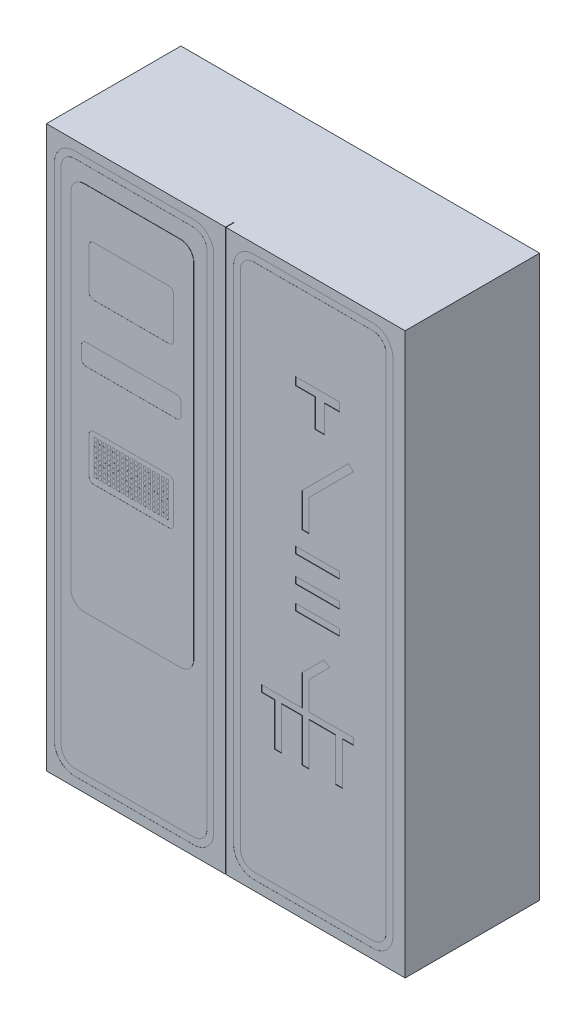
from build123d import *

# Parameters (mm, degrees)
CROQUIS1_W                 = 1600
CROQUIS1_H                 = 600
SALIENTE_EXTRUIR1_DEPTH    = 2500
CROQUIS2_W                 = 2
CROQUIS2_H                 = 2500
CORTAR_EXTRUIR1_DEPTH      = 38
CORTAR_EXTRUIR2_DEPTH      = 0.2
SALIENTE_EXTRUIR2_DEPTH    = 1
CROQUIS5_W                 = 195.337479374
CROQUIS5_H                 = 30
CORTAR_EXTRUIR3_DEPTH      = 2
CORTAR_EXTRUIR4_DEPTH      = 0.2
CROQUIS7_W                 = 12.38480667
CROQUIS7_H                 = 15.762481217
CORTAR_EXTRUIR5_DEPTH      = 0.1
MATRIZL1_COUNT             = 17
MATRIZL1_PITCH             = 20
MATRIZL2_COPY_1_SKETCH_W   = 12.38480667
MATRIZL2_COPY_1_SKETCH_H   = 15.762481217
MATRIZL2_COPY_1_DEPTH      = 0.1
MATRIZL2_COPY_2_SKETCH_W   = 12.38480667
MATRIZL2_COPY_2_SKETCH_H   = 15.762481217
MATRIZL2_COPY_2_DEPTH      = 0.1
MATRIZL2_COPY_3_SKETCH_W   = 12.38480667
MATRIZL2_COPY_3_SKETCH_H   = 15.762481217
MATRIZL2_COPY_3_DEPTH      = 0.1
MATRIZL2_COPY_4_SKETCH_W   = 12.38480667
MATRIZL2_COPY_4_SKETCH_H   = 15.762481217
MATRIZL2_COPY_4_DEPTH      = 0.1
MATRIZL2_COPY_5_SKETCH_W   = 12.38480667
MATRIZL2_COPY_5_SKETCH_H   = 15.762481217
MATRIZL2_COPY_5_DEPTH      = 0.1
MATRIZL2_COPY_6_SKETCH_W   = 12.38480667
MATRIZL2_COPY_6_SKETCH_H   = 15.762481217
MATRIZL2_COPY_6_DEPTH      = 0.1
MATRIZL2_COPY_7_SKETCH_W   = 12.38480667
MATRIZL2_COPY_7_SKETCH_H   = 15.762481217
MATRIZL2_COPY_7_DEPTH      = 0.1
MATRIZL2_COPY_8_SKETCH_W   = 12.38480667
MATRIZL2_COPY_8_SKETCH_H   = 15.762481217
MATRIZL2_COPY_8_DEPTH      = 0.1
MATRIZL2_COPY_9_SKETCH_W   = 12.38480667
MATRIZL2_COPY_9_SKETCH_H   = 15.762481217
MATRIZL2_COPY_9_DEPTH      = 0.1
MATRIZL2_COPY_10_SKETCH_W  = 12.38480667
MATRIZL2_COPY_10_SKETCH_H  = 15.762481217
MATRIZL2_COPY_10_DEPTH     = 0.1
MATRIZL2_COPY_11_SKETCH_W  = 12.38480667
MATRIZL2_COPY_11_SKETCH_H  = 15.762481217
MATRIZL2_COPY_11_DEPTH     = 0.1
MATRIZL2_COPY_12_SKETCH_W  = 12.38480667
MATRIZL2_COPY_12_SKETCH_H  = 15.762481217
MATRIZL2_COPY_12_DEPTH     = 0.1
MATRIZL2_COPY_13_SKETCH_W  = 12.38480667
MATRIZL2_COPY_13_SKETCH_H  = 15.762481217
MATRIZL2_COPY_13_DEPTH     = 0.1
MATRIZL2_COPY_14_SKETCH_W  = 12.38480667
MATRIZL2_COPY_14_SKETCH_H  = 15.762481217
MATRIZL2_COPY_14_DEPTH     = 0.1
MATRIZL2_COPY_15_SKETCH_W  = 12.38480667
MATRIZL2_COPY_15_SKETCH_H  = 15.762481217
MATRIZL2_COPY_15_DEPTH     = 0.1
MATRIZL2_COPY_16_SKETCH_W  = 12.38480667
MATRIZL2_COPY_16_SKETCH_H  = 15.762481217
MATRIZL2_COPY_16_DEPTH     = 0.1
MATRIZL2_COPY_17_SKETCH_W  = 12.38480667
MATRIZL2_COPY_17_SKETCH_H  = 15.762481217
MATRIZL2_COPY_17_DEPTH     = 0.1
MATRIZL2_COPY_18_SKETCH_W  = 12.38480667
MATRIZL2_COPY_18_SKETCH_H  = 15.762481217
MATRIZL2_COPY_18_DEPTH     = 0.1
MATRIZL2_COPY_19_SKETCH_W  = 12.38480667
MATRIZL2_COPY_19_SKETCH_H  = 15.762481217
MATRIZL2_COPY_19_DEPTH     = 0.1
MATRIZL2_COPY_20_SKETCH_W  = 12.38480667
MATRIZL2_COPY_20_SKETCH_H  = 15.762481217
MATRIZL2_COPY_20_DEPTH     = 0.1
MATRIZL2_COPY_21_SKETCH_W  = 12.38480667
MATRIZL2_COPY_21_SKETCH_H  = 15.762481217
MATRIZL2_COPY_21_DEPTH     = 0.1
MATRIZL2_COPY_22_SKETCH_W  = 12.38480667
MATRIZL2_COPY_22_SKETCH_H  = 15.762481217
MATRIZL2_COPY_22_DEPTH     = 0.1
MATRIZL2_COPY_23_SKETCH_W  = 12.38480667
MATRIZL2_COPY_23_SKETCH_H  = 15.762481217
MATRIZL2_COPY_23_DEPTH     = 0.1
MATRIZL2_COPY_24_SKETCH_W  = 12.38480667
MATRIZL2_COPY_24_SKETCH_H  = 15.762481217
MATRIZL2_COPY_24_DEPTH     = 0.1
MATRIZL2_COPY_25_SKETCH_W  = 12.38480667
MATRIZL2_COPY_25_SKETCH_H  = 15.762481217
MATRIZL2_COPY_25_DEPTH     = 0.1
MATRIZL2_COPY_26_SKETCH_W  = 12.38480667
MATRIZL2_COPY_26_SKETCH_H  = 15.762481217
MATRIZL2_COPY_26_DEPTH     = 0.1
MATRIZL2_COPY_27_SKETCH_W  = 12.38480667
MATRIZL2_COPY_27_SKETCH_H  = 15.762481217
MATRIZL2_COPY_27_DEPTH     = 0.1
MATRIZL2_COPY_28_SKETCH_W  = 12.38480667
MATRIZL2_COPY_28_SKETCH_H  = 15.762481217
MATRIZL2_COPY_28_DEPTH     = 0.1
MATRIZL2_COPY_29_SKETCH_W  = 12.38480667
MATRIZL2_COPY_29_SKETCH_H  = 15.762481217
MATRIZL2_COPY_29_DEPTH     = 0.1
MATRIZL2_COPY_30_SKETCH_W  = 12.38480667
MATRIZL2_COPY_30_SKETCH_H  = 15.762481217
MATRIZL2_COPY_30_DEPTH     = 0.1
MATRIZL2_COPY_31_SKETCH_W  = 12.38480667
MATRIZL2_COPY_31_SKETCH_H  = 15.762481217
MATRIZL2_COPY_31_DEPTH     = 0.1
MATRIZL2_COPY_32_SKETCH_W  = 12.38480667
MATRIZL2_COPY_32_SKETCH_H  = 15.762481217
MATRIZL2_COPY_32_DEPTH     = 0.1
MATRIZL2_COPY_33_SKETCH_W  = 12.38480667
MATRIZL2_COPY_33_SKETCH_H  = 15.762481217
MATRIZL2_COPY_33_DEPTH     = 0.1
MATRIZL2_COPY_34_SKETCH_W  = 12.38480667
MATRIZL2_COPY_34_SKETCH_H  = 15.762481217
MATRIZL2_COPY_34_DEPTH     = 0.1
MATRIZL2_COPY_35_SKETCH_W  = 12.38480667
MATRIZL2_COPY_35_SKETCH_H  = 15.762481217
MATRIZL2_COPY_35_DEPTH     = 0.1
MATRIZL2_COPY_36_SKETCH_W  = 12.38480667
MATRIZL2_COPY_36_SKETCH_H  = 15.762481217
MATRIZL2_COPY_36_DEPTH     = 0.1
MATRIZL2_COPY_37_SKETCH_W  = 12.38480667
MATRIZL2_COPY_37_SKETCH_H  = 15.762481217
MATRIZL2_COPY_37_DEPTH     = 0.1
MATRIZL2_COPY_38_SKETCH_W  = 12.38480667
MATRIZL2_COPY_38_SKETCH_H  = 15.762481217
MATRIZL2_COPY_38_DEPTH     = 0.1
MATRIZL2_COPY_39_SKETCH_W  = 12.38480667
MATRIZL2_COPY_39_SKETCH_H  = 15.762481217
MATRIZL2_COPY_39_DEPTH     = 0.1
MATRIZL2_COPY_40_SKETCH_W  = 12.38480667
MATRIZL2_COPY_40_SKETCH_H  = 15.762481217
MATRIZL2_COPY_40_DEPTH     = 0.1
MATRIZL2_COPY_41_SKETCH_W  = 12.38480667
MATRIZL2_COPY_41_SKETCH_H  = 15.762481217
MATRIZL2_COPY_41_DEPTH     = 0.1
MATRIZL2_COPY_42_SKETCH_W  = 12.38480667
MATRIZL2_COPY_42_SKETCH_H  = 15.762481217
MATRIZL2_COPY_42_DEPTH     = 0.1
MATRIZL2_COPY_43_SKETCH_W  = 12.38480667
MATRIZL2_COPY_43_SKETCH_H  = 15.762481217
MATRIZL2_COPY_43_DEPTH     = 0.1
MATRIZL2_COPY_44_SKETCH_W  = 12.38480667
MATRIZL2_COPY_44_SKETCH_H  = 15.762481217
MATRIZL2_COPY_44_DEPTH     = 0.1
MATRIZL2_COPY_45_SKETCH_W  = 12.38480667
MATRIZL2_COPY_45_SKETCH_H  = 15.762481217
MATRIZL2_COPY_45_DEPTH     = 0.1
MATRIZL2_COPY_46_SKETCH_W  = 12.38480667
MATRIZL2_COPY_46_SKETCH_H  = 15.762481217
MATRIZL2_COPY_46_DEPTH     = 0.1
MATRIZL2_COPY_47_SKETCH_W  = 12.38480667
MATRIZL2_COPY_47_SKETCH_H  = 15.762481217
MATRIZL2_COPY_47_DEPTH     = 0.1
MATRIZL2_COPY_48_SKETCH_W  = 12.38480667
MATRIZL2_COPY_48_SKETCH_H  = 15.762481217
MATRIZL2_COPY_48_DEPTH     = 0.1
MATRIZL2_COPY_49_SKETCH_W  = 12.38480667
MATRIZL2_COPY_49_SKETCH_H  = 15.762481217
MATRIZL2_COPY_49_DEPTH     = 0.1
MATRIZL2_COPY_50_SKETCH_W  = 12.38480667
MATRIZL2_COPY_50_SKETCH_H  = 15.762481217
MATRIZL2_COPY_50_DEPTH     = 0.1
MATRIZL2_COPY_51_SKETCH_W  = 12.38480667
MATRIZL2_COPY_51_SKETCH_H  = 15.762481217
MATRIZL2_COPY_51_DEPTH     = 0.1
MATRIZL2_COPY_52_SKETCH_W  = 12.38480667
MATRIZL2_COPY_52_SKETCH_H  = 15.762481217
MATRIZL2_COPY_52_DEPTH     = 0.1
MATRIZL2_COPY_53_SKETCH_W  = 12.38480667
MATRIZL2_COPY_53_SKETCH_H  = 15.762481217
MATRIZL2_COPY_53_DEPTH     = 0.1
MATRIZL2_COPY_54_SKETCH_W  = 12.38480667
MATRIZL2_COPY_54_SKETCH_H  = 15.762481217
MATRIZL2_COPY_54_DEPTH     = 0.1
MATRIZL2_COPY_55_SKETCH_W  = 12.38480667
MATRIZL2_COPY_55_SKETCH_H  = 15.762481217
MATRIZL2_COPY_55_DEPTH     = 0.1
MATRIZL2_COPY_56_SKETCH_W  = 12.38480667
MATRIZL2_COPY_56_SKETCH_H  = 15.762481217
MATRIZL2_COPY_56_DEPTH     = 0.1
MATRIZL2_COPY_57_SKETCH_W  = 12.38480667
MATRIZL2_COPY_57_SKETCH_H  = 15.762481217
MATRIZL2_COPY_57_DEPTH     = 0.1
MATRIZL2_COPY_58_SKETCH_W  = 12.38480667
MATRIZL2_COPY_58_SKETCH_H  = 15.762481217
MATRIZL2_COPY_58_DEPTH     = 0.1
MATRIZL2_COPY_59_SKETCH_W  = 12.38480667
MATRIZL2_COPY_59_SKETCH_H  = 15.762481217
MATRIZL2_COPY_59_DEPTH     = 0.1
MATRIZL2_COPY_60_SKETCH_W  = 12.38480667
MATRIZL2_COPY_60_SKETCH_H  = 15.762481217
MATRIZL2_COPY_60_DEPTH     = 0.1
MATRIZL2_COPY_61_SKETCH_W  = 12.38480667
MATRIZL2_COPY_61_SKETCH_H  = 15.762481217
MATRIZL2_COPY_61_DEPTH     = 0.1
MATRIZL2_COPY_62_SKETCH_W  = 12.38480667
MATRIZL2_COPY_62_SKETCH_H  = 15.762481217
MATRIZL2_COPY_62_DEPTH     = 0.1
MATRIZL2_COPY_63_SKETCH_W  = 12.38480667
MATRIZL2_COPY_63_SKETCH_H  = 15.762481217
MATRIZL2_COPY_63_DEPTH     = 0.1
MATRIZL2_COPY_64_SKETCH_W  = 12.38480667
MATRIZL2_COPY_64_SKETCH_H  = 15.762481217
MATRIZL2_COPY_64_DEPTH     = 0.1
MATRIZL2_COPY_65_SKETCH_W  = 12.38480667
MATRIZL2_COPY_65_SKETCH_H  = 15.762481217
MATRIZL2_COPY_65_DEPTH     = 0.1
MATRIZL2_COPY_66_SKETCH_W  = 12.38480667
MATRIZL2_COPY_66_SKETCH_H  = 15.762481217
MATRIZL2_COPY_66_DEPTH     = 0.1
MATRIZL2_COPY_67_SKETCH_W  = 12.38480667
MATRIZL2_COPY_67_SKETCH_H  = 15.762481217
MATRIZL2_COPY_67_DEPTH     = 0.1
MATRIZL2_COPY_68_SKETCH_W  = 12.38480667
MATRIZL2_COPY_68_SKETCH_H  = 15.762481217
MATRIZL2_COPY_68_DEPTH     = 0.1
MATRIZL2_COPY_69_SKETCH_W  = 12.38480667
MATRIZL2_COPY_69_SKETCH_H  = 15.762481217
MATRIZL2_COPY_69_DEPTH     = 0.1
MATRIZL2_COPY_70_SKETCH_W  = 12.38480667
MATRIZL2_COPY_70_SKETCH_H  = 15.762481217
MATRIZL2_COPY_70_DEPTH     = 0.1
MATRIZL2_COPY_71_SKETCH_W  = 12.38480667
MATRIZL2_COPY_71_SKETCH_H  = 15.762481217
MATRIZL2_COPY_71_DEPTH     = 0.1
MATRIZL2_COPY_72_SKETCH_W  = 12.38480667
MATRIZL2_COPY_72_SKETCH_H  = 15.762481217
MATRIZL2_COPY_72_DEPTH     = 0.1
MATRIZL2_COPY_73_SKETCH_W  = 12.38480667
MATRIZL2_COPY_73_SKETCH_H  = 15.762481217
MATRIZL2_COPY_73_DEPTH     = 0.1
MATRIZL2_COPY_74_SKETCH_W  = 12.38480667
MATRIZL2_COPY_74_SKETCH_H  = 15.762481217
MATRIZL2_COPY_74_DEPTH     = 0.1
MATRIZL2_COPY_75_SKETCH_W  = 12.38480667
MATRIZL2_COPY_75_SKETCH_H  = 15.762481217
MATRIZL2_COPY_75_DEPTH     = 0.1
MATRIZL2_COPY_76_SKETCH_W  = 12.38480667
MATRIZL2_COPY_76_SKETCH_H  = 15.762481217
MATRIZL2_COPY_76_DEPTH     = 0.1
MATRIZL2_COPY_77_SKETCH_W  = 12.38480667
MATRIZL2_COPY_77_SKETCH_H  = 15.762481217
MATRIZL2_COPY_77_DEPTH     = 0.1
MATRIZL2_COPY_78_SKETCH_W  = 12.38480667
MATRIZL2_COPY_78_SKETCH_H  = 15.762481217
MATRIZL2_COPY_78_DEPTH     = 0.1
MATRIZL2_COPY_79_SKETCH_W  = 12.38480667
MATRIZL2_COPY_79_SKETCH_H  = 15.762481217
MATRIZL2_COPY_79_DEPTH     = 0.1
MATRIZL2_COPY_80_SKETCH_W  = 12.38480667
MATRIZL2_COPY_80_SKETCH_H  = 15.762481217
MATRIZL2_COPY_80_DEPTH     = 0.1
MATRIZL2_COPY_81_SKETCH_W  = 12.38480667
MATRIZL2_COPY_81_SKETCH_H  = 15.762481217
MATRIZL2_COPY_81_DEPTH     = 0.1
MATRIZL2_COPY_82_SKETCH_W  = 12.38480667
MATRIZL2_COPY_82_SKETCH_H  = 15.762481217
MATRIZL2_COPY_82_DEPTH     = 0.1
MATRIZL2_COPY_83_SKETCH_W  = 12.38480667
MATRIZL2_COPY_83_SKETCH_H  = 15.762481217
MATRIZL2_COPY_83_DEPTH     = 0.1
MATRIZL2_COPY_84_SKETCH_W  = 12.38480667
MATRIZL2_COPY_84_SKETCH_H  = 15.762481217
MATRIZL2_COPY_84_DEPTH     = 0.1
MATRIZL2_COPY_85_SKETCH_W  = 12.38480667
MATRIZL2_COPY_85_SKETCH_H  = 15.762481217
MATRIZL2_COPY_85_DEPTH     = 0.1
MATRIZL2_COPY_86_SKETCH_W  = 12.38480667
MATRIZL2_COPY_86_SKETCH_H  = 15.762481217
MATRIZL2_COPY_86_DEPTH     = 0.1
MATRIZL2_COPY_87_SKETCH_W  = 12.38480667
MATRIZL2_COPY_87_SKETCH_H  = 15.762481217
MATRIZL2_COPY_87_DEPTH     = 0.1
MATRIZL2_COPY_88_SKETCH_W  = 12.38480667
MATRIZL2_COPY_88_SKETCH_H  = 15.762481217
MATRIZL2_COPY_88_DEPTH     = 0.1
MATRIZL2_COPY_89_SKETCH_W  = 12.38480667
MATRIZL2_COPY_89_SKETCH_H  = 15.762481217
MATRIZL2_COPY_89_DEPTH     = 0.1
MATRIZL2_COPY_90_SKETCH_W  = 12.38480667
MATRIZL2_COPY_90_SKETCH_H  = 15.762481217
MATRIZL2_COPY_90_DEPTH     = 0.1
MATRIZL2_COPY_91_SKETCH_W  = 12.38480667
MATRIZL2_COPY_91_SKETCH_H  = 15.762481217
MATRIZL2_COPY_91_DEPTH     = 0.1
MATRIZL2_COPY_92_SKETCH_W  = 12.38480667
MATRIZL2_COPY_92_SKETCH_H  = 15.762481217
MATRIZL2_COPY_92_DEPTH     = 0.1
MATRIZL2_COPY_93_SKETCH_W  = 12.38480667
MATRIZL2_COPY_93_SKETCH_H  = 15.762481217
MATRIZL2_COPY_93_DEPTH     = 0.1
MATRIZL2_COPY_94_SKETCH_W  = 12.38480667
MATRIZL2_COPY_94_SKETCH_H  = 15.762481217
MATRIZL2_COPY_94_DEPTH     = 0.1
MATRIZL2_COPY_95_SKETCH_W  = 12.38480667
MATRIZL2_COPY_95_SKETCH_H  = 15.762481217
MATRIZL2_COPY_95_DEPTH     = 0.1
MATRIZL2_COPY_96_SKETCH_W  = 12.38480667
MATRIZL2_COPY_96_SKETCH_H  = 15.762481217
MATRIZL2_COPY_96_DEPTH     = 0.1
MATRIZL2_COPY_97_SKETCH_W  = 12.38480667
MATRIZL2_COPY_97_SKETCH_H  = 15.762481217
MATRIZL2_COPY_97_DEPTH     = 0.1
MATRIZL2_COPY_98_SKETCH_W  = 12.38480667
MATRIZL2_COPY_98_SKETCH_H  = 15.762481217
MATRIZL2_COPY_98_DEPTH     = 0.1
MATRIZL2_COPY_99_SKETCH_W  = 12.38480667
MATRIZL2_COPY_99_SKETCH_H  = 15.762481217
MATRIZL2_COPY_99_DEPTH     = 0.1
MATRIZL2_COPY_100_SKETCH_W = 12.38480667
MATRIZL2_COPY_100_SKETCH_H = 15.762481217
MATRIZL2_COPY_100_DEPTH    = 0.1
MATRIZL2_COPY_101_SKETCH_W = 12.38480667
MATRIZL2_COPY_101_SKETCH_H = 15.762481217
MATRIZL2_COPY_101_DEPTH    = 0.1
MATRIZL2_COPY_102_SKETCH_W = 12.38480667
MATRIZL2_COPY_102_SKETCH_H = 15.762481217
MATRIZL2_COPY_102_DEPTH    = 0.1
MATRIZL2_COPY_103_SKETCH_W = 12.38480667
MATRIZL2_COPY_103_SKETCH_H = 15.762481217
MATRIZL2_COPY_103_DEPTH    = 0.1
MATRIZL2_COPY_104_SKETCH_W = 12.38480667
MATRIZL2_COPY_104_SKETCH_H = 15.762481217
MATRIZL2_COPY_104_DEPTH    = 0.1
MATRIZL2_COPY_105_SKETCH_W = 12.38480667
MATRIZL2_COPY_105_SKETCH_H = 15.762481217
MATRIZL2_COPY_105_DEPTH    = 0.1
MATRIZL2_COPY_106_SKETCH_W = 12.38480667
MATRIZL2_COPY_106_SKETCH_H = 15.762481217
MATRIZL2_COPY_106_DEPTH    = 0.1
MATRIZL2_COPY_107_SKETCH_W = 12.38480667
MATRIZL2_COPY_107_SKETCH_H = 15.762481217
MATRIZL2_COPY_107_DEPTH    = 0.1
MATRIZL2_COPY_108_SKETCH_W = 12.38480667
MATRIZL2_COPY_108_SKETCH_H = 15.762481217
MATRIZL2_COPY_108_DEPTH    = 0.1
MATRIZL2_COPY_109_SKETCH_W = 12.38480667
MATRIZL2_COPY_109_SKETCH_H = 15.762481217
MATRIZL2_COPY_109_DEPTH    = 0.1
MATRIZL2_COPY_110_SKETCH_W = 12.38480667
MATRIZL2_COPY_110_SKETCH_H = 15.762481217
MATRIZL2_COPY_110_DEPTH    = 0.1
MATRIZL2_COPY_111_SKETCH_W = 12.38480667
MATRIZL2_COPY_111_SKETCH_H = 15.762481217
MATRIZL2_COPY_111_DEPTH    = 0.1
MATRIZL2_COPY_112_SKETCH_W = 12.38480667
MATRIZL2_COPY_112_SKETCH_H = 15.762481217
MATRIZL2_COPY_112_DEPTH    = 0.1
MATRIZL2_COPY_113_SKETCH_W = 12.38480667
MATRIZL2_COPY_113_SKETCH_H = 15.762481217
MATRIZL2_COPY_113_DEPTH    = 0.1
MATRIZL2_COPY_114_SKETCH_W = 12.38480667
MATRIZL2_COPY_114_SKETCH_H = 15.762481217
MATRIZL2_COPY_114_DEPTH    = 0.1
MATRIZL2_COPY_115_SKETCH_W = 12.38480667
MATRIZL2_COPY_115_SKETCH_H = 15.762481217
MATRIZL2_COPY_115_DEPTH    = 0.1
MATRIZL2_COPY_116_SKETCH_W = 12.38480667
MATRIZL2_COPY_116_SKETCH_H = 15.762481217
MATRIZL2_COPY_116_DEPTH    = 0.1
MATRIZL2_COPY_117_SKETCH_W = 12.38480667
MATRIZL2_COPY_117_SKETCH_H = 15.762481217
MATRIZL2_COPY_117_DEPTH    = 0.1
MATRIZL2_COPY_118_SKETCH_W = 12.38480667
MATRIZL2_COPY_118_SKETCH_H = 15.762481217
MATRIZL2_COPY_118_DEPTH    = 0.1
MATRIZL2_COPY_119_SKETCH_W = 12.38480667
MATRIZL2_COPY_119_SKETCH_H = 15.762481217
MATRIZL2_COPY_119_DEPTH    = 0.1


with BuildPart() as part:
    # Croquis1 → Saliente-Extruir1 (new body)
    with BuildSketch(Plane(origin=(0, 0, 0), x_dir=(1, 0, 0), z_dir=(0, 1, 0))):
        Rectangle(CROQUIS1_W, CROQUIS1_H)
    extrude(amount=SALIENTE_EXTRUIR1_DEPTH)

    # Croquis2 → Cortar-Extruir1 (cut)
    with BuildSketch(Plane.XY.offset(300)):
        with Locations((0, 1250)):
            Rectangle(CROQUIS2_W, CROQUIS2_H)
    extrude(amount=-CORTAR_EXTRUIR1_DEPTH, mode=Mode.SUBTRACT)

    # Croquis3 → Cortar-Extruir2 (cut)
    # profile 1 of 2: a face of its own
    with BuildSketch(Plane.XY.offset(300)):
        with BuildLine():
            Line((-764.129970229, 2368.24689449), (-764.129970229, 132.91731919))
            ThreePointArc((-764.129970229, 132.91731919), (-737.769580535, 69.277708883), (-674.129970229, 42.91731919))
            Line((-674.129970229, 42.91731919), (-143.709851283, 42.91731919))
            ThreePointArc((-143.709851283, 42.91731919), (-80.070240976, 69.277708883), (-53.709851283, 132.91731919))
            Line((-53.709851283, 132.91731919), (-53.709851283, 2368.24689449))
            ThreePointArc((-53.709851283, 2368.24689449), (-80.070240976, 2431.886504796), (-143.709851283, 2458.24689449))
            Line((-143.709851283, 2458.24689449), (-674.129970229, 2458.24689449))
            ThreePointArc((-674.129970229, 2458.24689449), (-737.769580535, 2431.886504796), (-764.129970229, 2368.24689449))
        make_face()
        with BuildLine():
            Line((-674.129970229, 2428.24689449), (-143.709851283, 2428.24689449))
            ThreePointArc((-143.709851283, 2428.24689449), (-101.283444412, 2410.673301361), (-83.709851283, 2368.24689449))
            Line((-83.709851283, 2368.24689449), (-83.709851283, 132.91731919))
            ThreePointArc((-83.709851283, 132.91731919), (-101.283444412, 90.490912319), (-143.709851283, 72.91731919))
            Line((-143.709851283, 72.91731919), (-674.129970229, 72.91731919))
            ThreePointArc((-674.129970229, 72.91731919), (-716.5563771, 90.490912319), (-734.129970229, 132.91731919))
            Line((-734.129970229, 132.91731919), (-734.129970229, 2368.24689449))
            ThreePointArc((-734.129970229, 2368.24689449), (-716.5563771, 2410.673301361), (-674.129970229, 2428.24689449))
        make_face(mode=Mode.SUBTRACT)
    # profile 2 of 2: a face of its own
    with BuildSketch(Plane.XY.offset(300)):
        with BuildLine():
            Line((34.95246111, 2368.24689449), (34.95246111, 132.91731919))
            ThreePointArc((34.95246111, 132.91731919), (61.312850804, 69.277708883), (124.95246111, 42.91731919))
            Line((124.95246111, 42.91731919), (655.451268753, 42.91731919))
            ThreePointArc((655.451268753, 42.91731919), (719.09087906, 69.277708883), (745.451268753, 132.91731919))
            Line((745.451268753, 132.91731919), (745.451268753, 2368.24689449))
            ThreePointArc((745.451268753, 2368.24689449), (719.09087906, 2431.886504796), (655.451268753, 2458.24689449))
            Line((655.451268753, 2458.24689449), (124.95246111, 2458.24689449))
            ThreePointArc((124.95246111, 2458.24689449), (61.312850804, 2431.886504796), (34.95246111, 2368.24689449))
        make_face()
        with BuildLine():
            Line((124.95246111, 2428.24689449), (655.451268753, 2428.24689449))
            ThreePointArc((655.451268753, 2428.24689449), (697.877675624, 2410.673301361), (715.451268753, 2368.24689449))
            Line((715.451268753, 2368.24689449), (715.451268753, 132.91731919))
            ThreePointArc((715.451268753, 132.91731919), (697.877675624, 90.490912319), (655.451268753, 72.91731919))
            Line((655.451268753, 72.91731919), (124.95246111, 72.91731919))
            ThreePointArc((124.95246111, 72.91731919), (82.526054239, 90.490912319), (64.95246111, 132.91731919))
            Line((64.95246111, 132.91731919), (64.95246111, 2368.24689449))
            ThreePointArc((64.95246111, 2368.24689449), (82.526054239, 2410.673301361), (124.95246111, 2428.24689449))
        make_face(mode=Mode.SUBTRACT)
    extrude(amount=-CORTAR_EXTRUIR2_DEPTH, mode=Mode.SUBTRACT)

    # Croquis4 → Saliente-Extruir2 (add)
    with BuildSketch(Plane.XY.offset(300)):
        with BuildLine():
            Line((-630.013756061, 2353.350432348), (-202.197907749, 2353.350432348))
            ThreePointArc((-202.197907749, 2353.350432348), (-159.771500878, 2335.776839219), (-142.197907749, 2293.350432348))
            Line((-142.197907749, 2293.350432348), (-142.197907749, 759.432092658))
            ThreePointArc((-142.197907749, 759.432092658), (-159.771500878, 717.005685787), (-202.197907749, 699.432092658))
            Line((-202.197907749, 699.432092658), (-630.013756061, 699.432092658))
            ThreePointArc((-630.013756061, 699.432092658), (-672.440162932, 717.005685787), (-690.013756061, 759.432092658))
            Line((-690.013756061, 759.432092658), (-690.013756061, 2293.350432348))
            ThreePointArc((-690.013756061, 2293.350432348), (-672.440162932, 2335.776839219), (-630.013756061, 2353.350432348))
        make_face()
    extrude(amount=SALIENTE_EXTRUIR2_DEPTH)

    # Croquis5 → Cortar-Extruir3 (cut)
    with BuildSketch(Plane.XY.offset(300)):
        Polygon((311.799765799, 2078.615668989), (507.137245173, 2078.615668989), (507.137245173, 2039.934980004), (439.446039449, 2039.934980004), (439.446039449, 1918.090809701), (397.31773151, 1918.090809701), (397.31773151, 2043.483672507), (311.799765799, 2043.483672507), align=None)
        Polygon((370.592614677, 1501.602540651), (370.592614677, 1641.20814706), (569.516221506, 1840.131753889), (548.303018071, 1861.344957325), (340.592614677, 1653.634553931), (340.592614677, 1501.602540651), align=None)
        with Locations((409.468505486, 1409.024721372)):
            Rectangle(CROQUIS5_W, CROQUIS5_H)
        with Locations((409.468505486, 1292.722720187)):
            Rectangle(CROQUIS5_W, CROQUIS5_H)
        with Locations((409.468505486, 1188.451960504)):
            Rectangle(CROQUIS5_W, CROQUIS5_H)
        Polygon((370.592614677, 813.13863698), (370.592614677, 937.381637642), (464.562875876, 1032.152765097), (436.683600153, 1046.643467874), (340.592614677, 949.733542163), (340.592614677, 813.13863698), (158.769564919, 813.13863698), (158.769564919, 783.13863698), (217.65493501, 783.13863698), (217.65493501, 592.665256095), (247.913100219, 592.665256095), (247.913100219, 783.13863698), (340.592614677, 783.13863698), (340.592614677, 592.665256095), (370.592614677, 592.665256095), (370.592614677, 783.13863698), (488.522124181, 783.13863698), (488.522124181, 592.665256095), (521.234234802, 592.665256095), (521.234234802, 783.13863698), (569.949810577, 783.13863698), (569.949810577, 813.13863698), align=None)
    extrude(amount=-CORTAR_EXTRUIR3_DEPTH, mode=Mode.SUBTRACT)

    # Croquis6 → Cortar-Extruir4 (cut)
    with BuildSketch(Plane.XY.offset(301)):
        with BuildLine():
            Line((-588.399409887, 2147.50880953), (-252.127946216, 2147.50880953))
            ThreePointArc((-252.127946216, 2147.50880953), (-237.985810592, 2141.650945154), (-232.127946216, 2127.50880953))
            Line((-232.127946216, 2127.50880953), (-232.127946216, 1945.022276454))
            ThreePointArc((-232.127946216, 1945.022276454), (-237.985810592, 1930.88014083), (-252.127946216, 1925.022276454))
            Line((-252.127946216, 1925.022276454), (-588.399409887, 1925.022276454))
            ThreePointArc((-588.399409887, 1925.022276454), (-602.541545511, 1930.88014083), (-608.399409887, 1945.022276454))
            Line((-608.399409887, 1945.022276454), (-608.399409887, 2127.50880953))
            ThreePointArc((-608.399409887, 2127.50880953), (-602.541545511, 2141.650945154), (-588.399409887, 2147.50880953))
        make_face()
        with BuildLine():
            Line((-622.357218568, 1745.399800302), (-218.170137535, 1745.399800302))
            ThreePointArc((-218.170137535, 1745.399800302), (-204.028001911, 1739.541935926), (-198.170137535, 1725.399800302))
            Line((-198.170137535, 1725.399800302), (-198.170137535, 1671.589995818))
            ThreePointArc((-198.170137535, 1671.589995818), (-204.028001911, 1657.447860194), (-218.170137535, 1651.589995818))
            Line((-218.170137535, 1651.589995818), (-622.357218568, 1651.589995818))
            ThreePointArc((-622.357218568, 1651.589995818), (-636.499354192, 1657.447860194), (-642.357218568, 1671.589995818))
            Line((-642.357218568, 1671.589995818), (-642.357218568, 1725.399800302))
            ThreePointArc((-642.357218568, 1725.399800302), (-636.499354192, 1739.541935926), (-622.357218568, 1745.399800302))
        make_face()
        with BuildLine():
            Line((-588.399409887, 1417.900340398), (-252.127946216, 1417.900340398))
            ThreePointArc((-252.127946216, 1417.900340398), (-237.985810592, 1412.042476022), (-232.127946216, 1397.900340398))
            Line((-232.127946216, 1397.900340398), (-232.127946216, 1233.065040285))
            ThreePointArc((-232.127946216, 1233.065040285), (-237.985810592, 1218.922904661), (-252.127946216, 1213.065040285))
            Line((-252.127946216, 1213.065040285), (-588.399409887, 1213.065040285))
            ThreePointArc((-588.399409887, 1213.065040285), (-602.541545511, 1218.922904661), (-608.399409887, 1233.065040285))
            Line((-608.399409887, 1233.065040285), (-608.399409887, 1397.900340398))
            ThreePointArc((-608.399409887, 1397.900340398), (-602.541545511, 1412.042476022), (-588.399409887, 1417.900340398))
        make_face()
    extrude(amount=-CORTAR_EXTRUIR4_DEPTH, mode=Mode.SUBTRACT)

    # Croquis7 → Cortar-Extruir5 (cut)
    with BuildSketch(Plane.XY.offset(300.8)):
        with Locations((-580.017440385, 1389.395838527)):
            Rectangle(CROQUIS7_W, CROQUIS7_H)
    cortar_extruir5 = extrude(amount=-CORTAR_EXTRUIR5_DEPTH, mode=Mode.SUBTRACT)

    # MatrizL1: Cortar-Extruir5 ×17
    with Locations(*[(i * MATRIZL1_PITCH, 0, 0) for i in range(1, MATRIZL1_COUNT)]):
        add(cortar_extruir5, mode=Mode.SUBTRACT)

    # MatrizL2 copy 1 sketch → MatrizL2 copy 1 (cut)
    with BuildSketch(Plane(origin=(20, -20, 300.8), x_dir=(1, 0, 0), z_dir=(0, 0, 1))):
        with Locations((-580.017440385, 1389.395838527)):
            Rectangle(MATRIZL2_COPY_1_SKETCH_W, MATRIZL2_COPY_1_SKETCH_H)
    extrude(amount=-MATRIZL2_COPY_1_DEPTH, mode=Mode.SUBTRACT)

    # MatrizL2 copy 2 sketch → MatrizL2 copy 2 (cut)
    with BuildSketch(Plane(origin=(20, -40, 300.8), x_dir=(1, 0, 0), z_dir=(0, 0, 1))):
        with Locations((-580.017440385, 1389.395838527)):
            Rectangle(MATRIZL2_COPY_2_SKETCH_W, MATRIZL2_COPY_2_SKETCH_H)
    extrude(amount=-MATRIZL2_COPY_2_DEPTH, mode=Mode.SUBTRACT)

    # MatrizL2 copy 3 sketch → MatrizL2 copy 3 (cut)
    with BuildSketch(Plane(origin=(20, -60, 300.8), x_dir=(1, 0, 0), z_dir=(0, 0, 1))):
        with Locations((-580.017440385, 1389.395838527)):
            Rectangle(MATRIZL2_COPY_3_SKETCH_W, MATRIZL2_COPY_3_SKETCH_H)
    extrude(amount=-MATRIZL2_COPY_3_DEPTH, mode=Mode.SUBTRACT)

    # MatrizL2 copy 4 sketch → MatrizL2 copy 4 (cut)
    with BuildSketch(Plane(origin=(20, -80, 300.8), x_dir=(1, 0, 0), z_dir=(0, 0, 1))):
        with Locations((-580.017440385, 1389.395838527)):
            Rectangle(MATRIZL2_COPY_4_SKETCH_W, MATRIZL2_COPY_4_SKETCH_H)
    extrude(amount=-MATRIZL2_COPY_4_DEPTH, mode=Mode.SUBTRACT)

    # MatrizL2 copy 5 sketch → MatrizL2 copy 5 (cut)
    with BuildSketch(Plane(origin=(20, -100, 300.8), x_dir=(1, 0, 0), z_dir=(0, 0, 1))):
        with Locations((-580.017440385, 1389.395838527)):
            Rectangle(MATRIZL2_COPY_5_SKETCH_W, MATRIZL2_COPY_5_SKETCH_H)
    extrude(amount=-MATRIZL2_COPY_5_DEPTH, mode=Mode.SUBTRACT)

    # MatrizL2 copy 6 sketch → MatrizL2 copy 6 (cut)
    with BuildSketch(Plane(origin=(20, -120, 300.8), x_dir=(1, 0, 0), z_dir=(0, 0, 1))):
        with Locations((-580.017440385, 1389.395838527)):
            Rectangle(MATRIZL2_COPY_6_SKETCH_W, MATRIZL2_COPY_6_SKETCH_H)
    extrude(amount=-MATRIZL2_COPY_6_DEPTH, mode=Mode.SUBTRACT)

    # MatrizL2 copy 7 sketch → MatrizL2 copy 7 (cut)
    with BuildSketch(Plane(origin=(20, -140, 300.8), x_dir=(1, 0, 0), z_dir=(0, 0, 1))):
        with Locations((-580.017440385, 1389.395838527)):
            Rectangle(MATRIZL2_COPY_7_SKETCH_W, MATRIZL2_COPY_7_SKETCH_H)
    extrude(amount=-MATRIZL2_COPY_7_DEPTH, mode=Mode.SUBTRACT)

    # MatrizL2 copy 8 sketch → MatrizL2 copy 8 (cut)
    with BuildSketch(Plane(origin=(40, -20, 300.8), x_dir=(1, 0, 0), z_dir=(0, 0, 1))):
        with Locations((-580.017440385, 1389.395838527)):
            Rectangle(MATRIZL2_COPY_8_SKETCH_W, MATRIZL2_COPY_8_SKETCH_H)
    extrude(amount=-MATRIZL2_COPY_8_DEPTH, mode=Mode.SUBTRACT)

    # MatrizL2 copy 9 sketch → MatrizL2 copy 9 (cut)
    with BuildSketch(Plane(origin=(40, -40, 300.8), x_dir=(1, 0, 0), z_dir=(0, 0, 1))):
        with Locations((-580.017440385, 1389.395838527)):
            Rectangle(MATRIZL2_COPY_9_SKETCH_W, MATRIZL2_COPY_9_SKETCH_H)
    extrude(amount=-MATRIZL2_COPY_9_DEPTH, mode=Mode.SUBTRACT)

    # MatrizL2 copy 10 sketch → MatrizL2 copy 10 (cut)
    with BuildSketch(Plane(origin=(40, -60, 300.8), x_dir=(1, 0, 0), z_dir=(0, 0, 1))):
        with Locations((-580.017440385, 1389.395838527)):
            Rectangle(MATRIZL2_COPY_10_SKETCH_W, MATRIZL2_COPY_10_SKETCH_H)
    extrude(amount=-MATRIZL2_COPY_10_DEPTH, mode=Mode.SUBTRACT)

    # MatrizL2 copy 11 sketch → MatrizL2 copy 11 (cut)
    with BuildSketch(Plane(origin=(40, -80, 300.8), x_dir=(1, 0, 0), z_dir=(0, 0, 1))):
        with Locations((-580.017440385, 1389.395838527)):
            Rectangle(MATRIZL2_COPY_11_SKETCH_W, MATRIZL2_COPY_11_SKETCH_H)
    extrude(amount=-MATRIZL2_COPY_11_DEPTH, mode=Mode.SUBTRACT)

    # MatrizL2 copy 12 sketch → MatrizL2 copy 12 (cut)
    with BuildSketch(Plane(origin=(40, -100, 300.8), x_dir=(1, 0, 0), z_dir=(0, 0, 1))):
        with Locations((-580.017440385, 1389.395838527)):
            Rectangle(MATRIZL2_COPY_12_SKETCH_W, MATRIZL2_COPY_12_SKETCH_H)
    extrude(amount=-MATRIZL2_COPY_12_DEPTH, mode=Mode.SUBTRACT)

    # MatrizL2 copy 13 sketch → MatrizL2 copy 13 (cut)
    with BuildSketch(Plane(origin=(40, -120, 300.8), x_dir=(1, 0, 0), z_dir=(0, 0, 1))):
        with Locations((-580.017440385, 1389.395838527)):
            Rectangle(MATRIZL2_COPY_13_SKETCH_W, MATRIZL2_COPY_13_SKETCH_H)
    extrude(amount=-MATRIZL2_COPY_13_DEPTH, mode=Mode.SUBTRACT)

    # MatrizL2 copy 14 sketch → MatrizL2 copy 14 (cut)
    with BuildSketch(Plane(origin=(40, -140, 300.8), x_dir=(1, 0, 0), z_dir=(0, 0, 1))):
        with Locations((-580.017440385, 1389.395838527)):
            Rectangle(MATRIZL2_COPY_14_SKETCH_W, MATRIZL2_COPY_14_SKETCH_H)
    extrude(amount=-MATRIZL2_COPY_14_DEPTH, mode=Mode.SUBTRACT)

    # MatrizL2 copy 15 sketch → MatrizL2 copy 15 (cut)
    with BuildSketch(Plane(origin=(60, -20, 300.8), x_dir=(1, 0, 0), z_dir=(0, 0, 1))):
        with Locations((-580.017440385, 1389.395838527)):
            Rectangle(MATRIZL2_COPY_15_SKETCH_W, MATRIZL2_COPY_15_SKETCH_H)
    extrude(amount=-MATRIZL2_COPY_15_DEPTH, mode=Mode.SUBTRACT)

    # MatrizL2 copy 16 sketch → MatrizL2 copy 16 (cut)
    with BuildSketch(Plane(origin=(60, -40, 300.8), x_dir=(1, 0, 0), z_dir=(0, 0, 1))):
        with Locations((-580.017440385, 1389.395838527)):
            Rectangle(MATRIZL2_COPY_16_SKETCH_W, MATRIZL2_COPY_16_SKETCH_H)
    extrude(amount=-MATRIZL2_COPY_16_DEPTH, mode=Mode.SUBTRACT)

    # MatrizL2 copy 17 sketch → MatrizL2 copy 17 (cut)
    with BuildSketch(Plane(origin=(60, -60, 300.8), x_dir=(1, 0, 0), z_dir=(0, 0, 1))):
        with Locations((-580.017440385, 1389.395838527)):
            Rectangle(MATRIZL2_COPY_17_SKETCH_W, MATRIZL2_COPY_17_SKETCH_H)
    extrude(amount=-MATRIZL2_COPY_17_DEPTH, mode=Mode.SUBTRACT)

    # MatrizL2 copy 18 sketch → MatrizL2 copy 18 (cut)
    with BuildSketch(Plane(origin=(60, -80, 300.8), x_dir=(1, 0, 0), z_dir=(0, 0, 1))):
        with Locations((-580.017440385, 1389.395838527)):
            Rectangle(MATRIZL2_COPY_18_SKETCH_W, MATRIZL2_COPY_18_SKETCH_H)
    extrude(amount=-MATRIZL2_COPY_18_DEPTH, mode=Mode.SUBTRACT)

    # MatrizL2 copy 19 sketch → MatrizL2 copy 19 (cut)
    with BuildSketch(Plane(origin=(60, -100, 300.8), x_dir=(1, 0, 0), z_dir=(0, 0, 1))):
        with Locations((-580.017440385, 1389.395838527)):
            Rectangle(MATRIZL2_COPY_19_SKETCH_W, MATRIZL2_COPY_19_SKETCH_H)
    extrude(amount=-MATRIZL2_COPY_19_DEPTH, mode=Mode.SUBTRACT)

    # MatrizL2 copy 20 sketch → MatrizL2 copy 20 (cut)
    with BuildSketch(Plane(origin=(60, -120, 300.8), x_dir=(1, 0, 0), z_dir=(0, 0, 1))):
        with Locations((-580.017440385, 1389.395838527)):
            Rectangle(MATRIZL2_COPY_20_SKETCH_W, MATRIZL2_COPY_20_SKETCH_H)
    extrude(amount=-MATRIZL2_COPY_20_DEPTH, mode=Mode.SUBTRACT)

    # MatrizL2 copy 21 sketch → MatrizL2 copy 21 (cut)
    with BuildSketch(Plane(origin=(60, -140, 300.8), x_dir=(1, 0, 0), z_dir=(0, 0, 1))):
        with Locations((-580.017440385, 1389.395838527)):
            Rectangle(MATRIZL2_COPY_21_SKETCH_W, MATRIZL2_COPY_21_SKETCH_H)
    extrude(amount=-MATRIZL2_COPY_21_DEPTH, mode=Mode.SUBTRACT)

    # MatrizL2 copy 22 sketch → MatrizL2 copy 22 (cut)
    with BuildSketch(Plane(origin=(80, -20, 300.8), x_dir=(1, 0, 0), z_dir=(0, 0, 1))):
        with Locations((-580.017440385, 1389.395838527)):
            Rectangle(MATRIZL2_COPY_22_SKETCH_W, MATRIZL2_COPY_22_SKETCH_H)
    extrude(amount=-MATRIZL2_COPY_22_DEPTH, mode=Mode.SUBTRACT)

    # MatrizL2 copy 23 sketch → MatrizL2 copy 23 (cut)
    with BuildSketch(Plane(origin=(80, -40, 300.8), x_dir=(1, 0, 0), z_dir=(0, 0, 1))):
        with Locations((-580.017440385, 1389.395838527)):
            Rectangle(MATRIZL2_COPY_23_SKETCH_W, MATRIZL2_COPY_23_SKETCH_H)
    extrude(amount=-MATRIZL2_COPY_23_DEPTH, mode=Mode.SUBTRACT)

    # MatrizL2 copy 24 sketch → MatrizL2 copy 24 (cut)
    with BuildSketch(Plane(origin=(80, -60, 300.8), x_dir=(1, 0, 0), z_dir=(0, 0, 1))):
        with Locations((-580.017440385, 1389.395838527)):
            Rectangle(MATRIZL2_COPY_24_SKETCH_W, MATRIZL2_COPY_24_SKETCH_H)
    extrude(amount=-MATRIZL2_COPY_24_DEPTH, mode=Mode.SUBTRACT)

    # MatrizL2 copy 25 sketch → MatrizL2 copy 25 (cut)
    with BuildSketch(Plane(origin=(80, -80, 300.8), x_dir=(1, 0, 0), z_dir=(0, 0, 1))):
        with Locations((-580.017440385, 1389.395838527)):
            Rectangle(MATRIZL2_COPY_25_SKETCH_W, MATRIZL2_COPY_25_SKETCH_H)
    extrude(amount=-MATRIZL2_COPY_25_DEPTH, mode=Mode.SUBTRACT)

    # MatrizL2 copy 26 sketch → MatrizL2 copy 26 (cut)
    with BuildSketch(Plane(origin=(80, -100, 300.8), x_dir=(1, 0, 0), z_dir=(0, 0, 1))):
        with Locations((-580.017440385, 1389.395838527)):
            Rectangle(MATRIZL2_COPY_26_SKETCH_W, MATRIZL2_COPY_26_SKETCH_H)
    extrude(amount=-MATRIZL2_COPY_26_DEPTH, mode=Mode.SUBTRACT)

    # MatrizL2 copy 27 sketch → MatrizL2 copy 27 (cut)
    with BuildSketch(Plane(origin=(80, -120, 300.8), x_dir=(1, 0, 0), z_dir=(0, 0, 1))):
        with Locations((-580.017440385, 1389.395838527)):
            Rectangle(MATRIZL2_COPY_27_SKETCH_W, MATRIZL2_COPY_27_SKETCH_H)
    extrude(amount=-MATRIZL2_COPY_27_DEPTH, mode=Mode.SUBTRACT)

    # MatrizL2 copy 28 sketch → MatrizL2 copy 28 (cut)
    with BuildSketch(Plane(origin=(80, -140, 300.8), x_dir=(1, 0, 0), z_dir=(0, 0, 1))):
        with Locations((-580.017440385, 1389.395838527)):
            Rectangle(MATRIZL2_COPY_28_SKETCH_W, MATRIZL2_COPY_28_SKETCH_H)
    extrude(amount=-MATRIZL2_COPY_28_DEPTH, mode=Mode.SUBTRACT)

    # MatrizL2 copy 29 sketch → MatrizL2 copy 29 (cut)
    with BuildSketch(Plane(origin=(100, -20, 300.8), x_dir=(1, 0, 0), z_dir=(0, 0, 1))):
        with Locations((-580.017440385, 1389.395838527)):
            Rectangle(MATRIZL2_COPY_29_SKETCH_W, MATRIZL2_COPY_29_SKETCH_H)
    extrude(amount=-MATRIZL2_COPY_29_DEPTH, mode=Mode.SUBTRACT)

    # MatrizL2 copy 30 sketch → MatrizL2 copy 30 (cut)
    with BuildSketch(Plane(origin=(100, -40, 300.8), x_dir=(1, 0, 0), z_dir=(0, 0, 1))):
        with Locations((-580.017440385, 1389.395838527)):
            Rectangle(MATRIZL2_COPY_30_SKETCH_W, MATRIZL2_COPY_30_SKETCH_H)
    extrude(amount=-MATRIZL2_COPY_30_DEPTH, mode=Mode.SUBTRACT)

    # MatrizL2 copy 31 sketch → MatrizL2 copy 31 (cut)
    with BuildSketch(Plane(origin=(100, -60, 300.8), x_dir=(1, 0, 0), z_dir=(0, 0, 1))):
        with Locations((-580.017440385, 1389.395838527)):
            Rectangle(MATRIZL2_COPY_31_SKETCH_W, MATRIZL2_COPY_31_SKETCH_H)
    extrude(amount=-MATRIZL2_COPY_31_DEPTH, mode=Mode.SUBTRACT)

    # MatrizL2 copy 32 sketch → MatrizL2 copy 32 (cut)
    with BuildSketch(Plane(origin=(100, -80, 300.8), x_dir=(1, 0, 0), z_dir=(0, 0, 1))):
        with Locations((-580.017440385, 1389.395838527)):
            Rectangle(MATRIZL2_COPY_32_SKETCH_W, MATRIZL2_COPY_32_SKETCH_H)
    extrude(amount=-MATRIZL2_COPY_32_DEPTH, mode=Mode.SUBTRACT)

    # MatrizL2 copy 33 sketch → MatrizL2 copy 33 (cut)
    with BuildSketch(Plane(origin=(100, -100, 300.8), x_dir=(1, 0, 0), z_dir=(0, 0, 1))):
        with Locations((-580.017440385, 1389.395838527)):
            Rectangle(MATRIZL2_COPY_33_SKETCH_W, MATRIZL2_COPY_33_SKETCH_H)
    extrude(amount=-MATRIZL2_COPY_33_DEPTH, mode=Mode.SUBTRACT)

    # MatrizL2 copy 34 sketch → MatrizL2 copy 34 (cut)
    with BuildSketch(Plane(origin=(100, -120, 300.8), x_dir=(1, 0, 0), z_dir=(0, 0, 1))):
        with Locations((-580.017440385, 1389.395838527)):
            Rectangle(MATRIZL2_COPY_34_SKETCH_W, MATRIZL2_COPY_34_SKETCH_H)
    extrude(amount=-MATRIZL2_COPY_34_DEPTH, mode=Mode.SUBTRACT)

    # MatrizL2 copy 35 sketch → MatrizL2 copy 35 (cut)
    with BuildSketch(Plane(origin=(100, -140, 300.8), x_dir=(1, 0, 0), z_dir=(0, 0, 1))):
        with Locations((-580.017440385, 1389.395838527)):
            Rectangle(MATRIZL2_COPY_35_SKETCH_W, MATRIZL2_COPY_35_SKETCH_H)
    extrude(amount=-MATRIZL2_COPY_35_DEPTH, mode=Mode.SUBTRACT)

    # MatrizL2 copy 36 sketch → MatrizL2 copy 36 (cut)
    with BuildSketch(Plane(origin=(120, -20, 300.8), x_dir=(1, 0, 0), z_dir=(0, 0, 1))):
        with Locations((-580.017440385, 1389.395838527)):
            Rectangle(MATRIZL2_COPY_36_SKETCH_W, MATRIZL2_COPY_36_SKETCH_H)
    extrude(amount=-MATRIZL2_COPY_36_DEPTH, mode=Mode.SUBTRACT)

    # MatrizL2 copy 37 sketch → MatrizL2 copy 37 (cut)
    with BuildSketch(Plane(origin=(120, -40, 300.8), x_dir=(1, 0, 0), z_dir=(0, 0, 1))):
        with Locations((-580.017440385, 1389.395838527)):
            Rectangle(MATRIZL2_COPY_37_SKETCH_W, MATRIZL2_COPY_37_SKETCH_H)
    extrude(amount=-MATRIZL2_COPY_37_DEPTH, mode=Mode.SUBTRACT)

    # MatrizL2 copy 38 sketch → MatrizL2 copy 38 (cut)
    with BuildSketch(Plane(origin=(120, -60, 300.8), x_dir=(1, 0, 0), z_dir=(0, 0, 1))):
        with Locations((-580.017440385, 1389.395838527)):
            Rectangle(MATRIZL2_COPY_38_SKETCH_W, MATRIZL2_COPY_38_SKETCH_H)
    extrude(amount=-MATRIZL2_COPY_38_DEPTH, mode=Mode.SUBTRACT)

    # MatrizL2 copy 39 sketch → MatrizL2 copy 39 (cut)
    with BuildSketch(Plane(origin=(120, -80, 300.8), x_dir=(1, 0, 0), z_dir=(0, 0, 1))):
        with Locations((-580.017440385, 1389.395838527)):
            Rectangle(MATRIZL2_COPY_39_SKETCH_W, MATRIZL2_COPY_39_SKETCH_H)
    extrude(amount=-MATRIZL2_COPY_39_DEPTH, mode=Mode.SUBTRACT)

    # MatrizL2 copy 40 sketch → MatrizL2 copy 40 (cut)
    with BuildSketch(Plane(origin=(120, -100, 300.8), x_dir=(1, 0, 0), z_dir=(0, 0, 1))):
        with Locations((-580.017440385, 1389.395838527)):
            Rectangle(MATRIZL2_COPY_40_SKETCH_W, MATRIZL2_COPY_40_SKETCH_H)
    extrude(amount=-MATRIZL2_COPY_40_DEPTH, mode=Mode.SUBTRACT)

    # MatrizL2 copy 41 sketch → MatrizL2 copy 41 (cut)
    with BuildSketch(Plane(origin=(120, -120, 300.8), x_dir=(1, 0, 0), z_dir=(0, 0, 1))):
        with Locations((-580.017440385, 1389.395838527)):
            Rectangle(MATRIZL2_COPY_41_SKETCH_W, MATRIZL2_COPY_41_SKETCH_H)
    extrude(amount=-MATRIZL2_COPY_41_DEPTH, mode=Mode.SUBTRACT)

    # MatrizL2 copy 42 sketch → MatrizL2 copy 42 (cut)
    with BuildSketch(Plane(origin=(120, -140, 300.8), x_dir=(1, 0, 0), z_dir=(0, 0, 1))):
        with Locations((-580.017440385, 1389.395838527)):
            Rectangle(MATRIZL2_COPY_42_SKETCH_W, MATRIZL2_COPY_42_SKETCH_H)
    extrude(amount=-MATRIZL2_COPY_42_DEPTH, mode=Mode.SUBTRACT)

    # MatrizL2 copy 43 sketch → MatrizL2 copy 43 (cut)
    with BuildSketch(Plane(origin=(140, -20, 300.8), x_dir=(1, 0, 0), z_dir=(0, 0, 1))):
        with Locations((-580.017440385, 1389.395838527)):
            Rectangle(MATRIZL2_COPY_43_SKETCH_W, MATRIZL2_COPY_43_SKETCH_H)
    extrude(amount=-MATRIZL2_COPY_43_DEPTH, mode=Mode.SUBTRACT)

    # MatrizL2 copy 44 sketch → MatrizL2 copy 44 (cut)
    with BuildSketch(Plane(origin=(140, -40, 300.8), x_dir=(1, 0, 0), z_dir=(0, 0, 1))):
        with Locations((-580.017440385, 1389.395838527)):
            Rectangle(MATRIZL2_COPY_44_SKETCH_W, MATRIZL2_COPY_44_SKETCH_H)
    extrude(amount=-MATRIZL2_COPY_44_DEPTH, mode=Mode.SUBTRACT)

    # MatrizL2 copy 45 sketch → MatrizL2 copy 45 (cut)
    with BuildSketch(Plane(origin=(140, -60, 300.8), x_dir=(1, 0, 0), z_dir=(0, 0, 1))):
        with Locations((-580.017440385, 1389.395838527)):
            Rectangle(MATRIZL2_COPY_45_SKETCH_W, MATRIZL2_COPY_45_SKETCH_H)
    extrude(amount=-MATRIZL2_COPY_45_DEPTH, mode=Mode.SUBTRACT)

    # MatrizL2 copy 46 sketch → MatrizL2 copy 46 (cut)
    with BuildSketch(Plane(origin=(140, -80, 300.8), x_dir=(1, 0, 0), z_dir=(0, 0, 1))):
        with Locations((-580.017440385, 1389.395838527)):
            Rectangle(MATRIZL2_COPY_46_SKETCH_W, MATRIZL2_COPY_46_SKETCH_H)
    extrude(amount=-MATRIZL2_COPY_46_DEPTH, mode=Mode.SUBTRACT)

    # MatrizL2 copy 47 sketch → MatrizL2 copy 47 (cut)
    with BuildSketch(Plane(origin=(140, -100, 300.8), x_dir=(1, 0, 0), z_dir=(0, 0, 1))):
        with Locations((-580.017440385, 1389.395838527)):
            Rectangle(MATRIZL2_COPY_47_SKETCH_W, MATRIZL2_COPY_47_SKETCH_H)
    extrude(amount=-MATRIZL2_COPY_47_DEPTH, mode=Mode.SUBTRACT)

    # MatrizL2 copy 48 sketch → MatrizL2 copy 48 (cut)
    with BuildSketch(Plane(origin=(140, -120, 300.8), x_dir=(1, 0, 0), z_dir=(0, 0, 1))):
        with Locations((-580.017440385, 1389.395838527)):
            Rectangle(MATRIZL2_COPY_48_SKETCH_W, MATRIZL2_COPY_48_SKETCH_H)
    extrude(amount=-MATRIZL2_COPY_48_DEPTH, mode=Mode.SUBTRACT)

    # MatrizL2 copy 49 sketch → MatrizL2 copy 49 (cut)
    with BuildSketch(Plane(origin=(140, -140, 300.8), x_dir=(1, 0, 0), z_dir=(0, 0, 1))):
        with Locations((-580.017440385, 1389.395838527)):
            Rectangle(MATRIZL2_COPY_49_SKETCH_W, MATRIZL2_COPY_49_SKETCH_H)
    extrude(amount=-MATRIZL2_COPY_49_DEPTH, mode=Mode.SUBTRACT)

    # MatrizL2 copy 50 sketch → MatrizL2 copy 50 (cut)
    with BuildSketch(Plane(origin=(160, -20, 300.8), x_dir=(1, 0, 0), z_dir=(0, 0, 1))):
        with Locations((-580.017440385, 1389.395838527)):
            Rectangle(MATRIZL2_COPY_50_SKETCH_W, MATRIZL2_COPY_50_SKETCH_H)
    extrude(amount=-MATRIZL2_COPY_50_DEPTH, mode=Mode.SUBTRACT)

    # MatrizL2 copy 51 sketch → MatrizL2 copy 51 (cut)
    with BuildSketch(Plane(origin=(160, -40, 300.8), x_dir=(1, 0, 0), z_dir=(0, 0, 1))):
        with Locations((-580.017440385, 1389.395838527)):
            Rectangle(MATRIZL2_COPY_51_SKETCH_W, MATRIZL2_COPY_51_SKETCH_H)
    extrude(amount=-MATRIZL2_COPY_51_DEPTH, mode=Mode.SUBTRACT)

    # MatrizL2 copy 52 sketch → MatrizL2 copy 52 (cut)
    with BuildSketch(Plane(origin=(160, -60, 300.8), x_dir=(1, 0, 0), z_dir=(0, 0, 1))):
        with Locations((-580.017440385, 1389.395838527)):
            Rectangle(MATRIZL2_COPY_52_SKETCH_W, MATRIZL2_COPY_52_SKETCH_H)
    extrude(amount=-MATRIZL2_COPY_52_DEPTH, mode=Mode.SUBTRACT)

    # MatrizL2 copy 53 sketch → MatrizL2 copy 53 (cut)
    with BuildSketch(Plane(origin=(160, -80, 300.8), x_dir=(1, 0, 0), z_dir=(0, 0, 1))):
        with Locations((-580.017440385, 1389.395838527)):
            Rectangle(MATRIZL2_COPY_53_SKETCH_W, MATRIZL2_COPY_53_SKETCH_H)
    extrude(amount=-MATRIZL2_COPY_53_DEPTH, mode=Mode.SUBTRACT)

    # MatrizL2 copy 54 sketch → MatrizL2 copy 54 (cut)
    with BuildSketch(Plane(origin=(160, -100, 300.8), x_dir=(1, 0, 0), z_dir=(0, 0, 1))):
        with Locations((-580.017440385, 1389.395838527)):
            Rectangle(MATRIZL2_COPY_54_SKETCH_W, MATRIZL2_COPY_54_SKETCH_H)
    extrude(amount=-MATRIZL2_COPY_54_DEPTH, mode=Mode.SUBTRACT)

    # MatrizL2 copy 55 sketch → MatrizL2 copy 55 (cut)
    with BuildSketch(Plane(origin=(160, -120, 300.8), x_dir=(1, 0, 0), z_dir=(0, 0, 1))):
        with Locations((-580.017440385, 1389.395838527)):
            Rectangle(MATRIZL2_COPY_55_SKETCH_W, MATRIZL2_COPY_55_SKETCH_H)
    extrude(amount=-MATRIZL2_COPY_55_DEPTH, mode=Mode.SUBTRACT)

    # MatrizL2 copy 56 sketch → MatrizL2 copy 56 (cut)
    with BuildSketch(Plane(origin=(160, -140, 300.8), x_dir=(1, 0, 0), z_dir=(0, 0, 1))):
        with Locations((-580.017440385, 1389.395838527)):
            Rectangle(MATRIZL2_COPY_56_SKETCH_W, MATRIZL2_COPY_56_SKETCH_H)
    extrude(amount=-MATRIZL2_COPY_56_DEPTH, mode=Mode.SUBTRACT)

    # MatrizL2 copy 57 sketch → MatrizL2 copy 57 (cut)
    with BuildSketch(Plane(origin=(180, -20, 300.8), x_dir=(1, 0, 0), z_dir=(0, 0, 1))):
        with Locations((-580.017440385, 1389.395838527)):
            Rectangle(MATRIZL2_COPY_57_SKETCH_W, MATRIZL2_COPY_57_SKETCH_H)
    extrude(amount=-MATRIZL2_COPY_57_DEPTH, mode=Mode.SUBTRACT)

    # MatrizL2 copy 58 sketch → MatrizL2 copy 58 (cut)
    with BuildSketch(Plane(origin=(180, -40, 300.8), x_dir=(1, 0, 0), z_dir=(0, 0, 1))):
        with Locations((-580.017440385, 1389.395838527)):
            Rectangle(MATRIZL2_COPY_58_SKETCH_W, MATRIZL2_COPY_58_SKETCH_H)
    extrude(amount=-MATRIZL2_COPY_58_DEPTH, mode=Mode.SUBTRACT)

    # MatrizL2 copy 59 sketch → MatrizL2 copy 59 (cut)
    with BuildSketch(Plane(origin=(180, -60, 300.8), x_dir=(1, 0, 0), z_dir=(0, 0, 1))):
        with Locations((-580.017440385, 1389.395838527)):
            Rectangle(MATRIZL2_COPY_59_SKETCH_W, MATRIZL2_COPY_59_SKETCH_H)
    extrude(amount=-MATRIZL2_COPY_59_DEPTH, mode=Mode.SUBTRACT)

    # MatrizL2 copy 60 sketch → MatrizL2 copy 60 (cut)
    with BuildSketch(Plane(origin=(180, -80, 300.8), x_dir=(1, 0, 0), z_dir=(0, 0, 1))):
        with Locations((-580.017440385, 1389.395838527)):
            Rectangle(MATRIZL2_COPY_60_SKETCH_W, MATRIZL2_COPY_60_SKETCH_H)
    extrude(amount=-MATRIZL2_COPY_60_DEPTH, mode=Mode.SUBTRACT)

    # MatrizL2 copy 61 sketch → MatrizL2 copy 61 (cut)
    with BuildSketch(Plane(origin=(180, -100, 300.8), x_dir=(1, 0, 0), z_dir=(0, 0, 1))):
        with Locations((-580.017440385, 1389.395838527)):
            Rectangle(MATRIZL2_COPY_61_SKETCH_W, MATRIZL2_COPY_61_SKETCH_H)
    extrude(amount=-MATRIZL2_COPY_61_DEPTH, mode=Mode.SUBTRACT)

    # MatrizL2 copy 62 sketch → MatrizL2 copy 62 (cut)
    with BuildSketch(Plane(origin=(180, -120, 300.8), x_dir=(1, 0, 0), z_dir=(0, 0, 1))):
        with Locations((-580.017440385, 1389.395838527)):
            Rectangle(MATRIZL2_COPY_62_SKETCH_W, MATRIZL2_COPY_62_SKETCH_H)
    extrude(amount=-MATRIZL2_COPY_62_DEPTH, mode=Mode.SUBTRACT)

    # MatrizL2 copy 63 sketch → MatrizL2 copy 63 (cut)
    with BuildSketch(Plane(origin=(180, -140, 300.8), x_dir=(1, 0, 0), z_dir=(0, 0, 1))):
        with Locations((-580.017440385, 1389.395838527)):
            Rectangle(MATRIZL2_COPY_63_SKETCH_W, MATRIZL2_COPY_63_SKETCH_H)
    extrude(amount=-MATRIZL2_COPY_63_DEPTH, mode=Mode.SUBTRACT)

    # MatrizL2 copy 64 sketch → MatrizL2 copy 64 (cut)
    with BuildSketch(Plane(origin=(200, -20, 300.8), x_dir=(1, 0, 0), z_dir=(0, 0, 1))):
        with Locations((-580.017440385, 1389.395838527)):
            Rectangle(MATRIZL2_COPY_64_SKETCH_W, MATRIZL2_COPY_64_SKETCH_H)
    extrude(amount=-MATRIZL2_COPY_64_DEPTH, mode=Mode.SUBTRACT)

    # MatrizL2 copy 65 sketch → MatrizL2 copy 65 (cut)
    with BuildSketch(Plane(origin=(200, -40, 300.8), x_dir=(1, 0, 0), z_dir=(0, 0, 1))):
        with Locations((-580.017440385, 1389.395838527)):
            Rectangle(MATRIZL2_COPY_65_SKETCH_W, MATRIZL2_COPY_65_SKETCH_H)
    extrude(amount=-MATRIZL2_COPY_65_DEPTH, mode=Mode.SUBTRACT)

    # MatrizL2 copy 66 sketch → MatrizL2 copy 66 (cut)
    with BuildSketch(Plane(origin=(200, -60, 300.8), x_dir=(1, 0, 0), z_dir=(0, 0, 1))):
        with Locations((-580.017440385, 1389.395838527)):
            Rectangle(MATRIZL2_COPY_66_SKETCH_W, MATRIZL2_COPY_66_SKETCH_H)
    extrude(amount=-MATRIZL2_COPY_66_DEPTH, mode=Mode.SUBTRACT)

    # MatrizL2 copy 67 sketch → MatrizL2 copy 67 (cut)
    with BuildSketch(Plane(origin=(200, -80, 300.8), x_dir=(1, 0, 0), z_dir=(0, 0, 1))):
        with Locations((-580.017440385, 1389.395838527)):
            Rectangle(MATRIZL2_COPY_67_SKETCH_W, MATRIZL2_COPY_67_SKETCH_H)
    extrude(amount=-MATRIZL2_COPY_67_DEPTH, mode=Mode.SUBTRACT)

    # MatrizL2 copy 68 sketch → MatrizL2 copy 68 (cut)
    with BuildSketch(Plane(origin=(200, -100, 300.8), x_dir=(1, 0, 0), z_dir=(0, 0, 1))):
        with Locations((-580.017440385, 1389.395838527)):
            Rectangle(MATRIZL2_COPY_68_SKETCH_W, MATRIZL2_COPY_68_SKETCH_H)
    extrude(amount=-MATRIZL2_COPY_68_DEPTH, mode=Mode.SUBTRACT)

    # MatrizL2 copy 69 sketch → MatrizL2 copy 69 (cut)
    with BuildSketch(Plane(origin=(200, -120, 300.8), x_dir=(1, 0, 0), z_dir=(0, 0, 1))):
        with Locations((-580.017440385, 1389.395838527)):
            Rectangle(MATRIZL2_COPY_69_SKETCH_W, MATRIZL2_COPY_69_SKETCH_H)
    extrude(amount=-MATRIZL2_COPY_69_DEPTH, mode=Mode.SUBTRACT)

    # MatrizL2 copy 70 sketch → MatrizL2 copy 70 (cut)
    with BuildSketch(Plane(origin=(200, -140, 300.8), x_dir=(1, 0, 0), z_dir=(0, 0, 1))):
        with Locations((-580.017440385, 1389.395838527)):
            Rectangle(MATRIZL2_COPY_70_SKETCH_W, MATRIZL2_COPY_70_SKETCH_H)
    extrude(amount=-MATRIZL2_COPY_70_DEPTH, mode=Mode.SUBTRACT)

    # MatrizL2 copy 71 sketch → MatrizL2 copy 71 (cut)
    with BuildSketch(Plane(origin=(220, -20, 300.8), x_dir=(1, 0, 0), z_dir=(0, 0, 1))):
        with Locations((-580.017440385, 1389.395838527)):
            Rectangle(MATRIZL2_COPY_71_SKETCH_W, MATRIZL2_COPY_71_SKETCH_H)
    extrude(amount=-MATRIZL2_COPY_71_DEPTH, mode=Mode.SUBTRACT)

    # MatrizL2 copy 72 sketch → MatrizL2 copy 72 (cut)
    with BuildSketch(Plane(origin=(220, -40, 300.8), x_dir=(1, 0, 0), z_dir=(0, 0, 1))):
        with Locations((-580.017440385, 1389.395838527)):
            Rectangle(MATRIZL2_COPY_72_SKETCH_W, MATRIZL2_COPY_72_SKETCH_H)
    extrude(amount=-MATRIZL2_COPY_72_DEPTH, mode=Mode.SUBTRACT)

    # MatrizL2 copy 73 sketch → MatrizL2 copy 73 (cut)
    with BuildSketch(Plane(origin=(220, -60, 300.8), x_dir=(1, 0, 0), z_dir=(0, 0, 1))):
        with Locations((-580.017440385, 1389.395838527)):
            Rectangle(MATRIZL2_COPY_73_SKETCH_W, MATRIZL2_COPY_73_SKETCH_H)
    extrude(amount=-MATRIZL2_COPY_73_DEPTH, mode=Mode.SUBTRACT)

    # MatrizL2 copy 74 sketch → MatrizL2 copy 74 (cut)
    with BuildSketch(Plane(origin=(220, -80, 300.8), x_dir=(1, 0, 0), z_dir=(0, 0, 1))):
        with Locations((-580.017440385, 1389.395838527)):
            Rectangle(MATRIZL2_COPY_74_SKETCH_W, MATRIZL2_COPY_74_SKETCH_H)
    extrude(amount=-MATRIZL2_COPY_74_DEPTH, mode=Mode.SUBTRACT)

    # MatrizL2 copy 75 sketch → MatrizL2 copy 75 (cut)
    with BuildSketch(Plane(origin=(220, -100, 300.8), x_dir=(1, 0, 0), z_dir=(0, 0, 1))):
        with Locations((-580.017440385, 1389.395838527)):
            Rectangle(MATRIZL2_COPY_75_SKETCH_W, MATRIZL2_COPY_75_SKETCH_H)
    extrude(amount=-MATRIZL2_COPY_75_DEPTH, mode=Mode.SUBTRACT)

    # MatrizL2 copy 76 sketch → MatrizL2 copy 76 (cut)
    with BuildSketch(Plane(origin=(220, -120, 300.8), x_dir=(1, 0, 0), z_dir=(0, 0, 1))):
        with Locations((-580.017440385, 1389.395838527)):
            Rectangle(MATRIZL2_COPY_76_SKETCH_W, MATRIZL2_COPY_76_SKETCH_H)
    extrude(amount=-MATRIZL2_COPY_76_DEPTH, mode=Mode.SUBTRACT)

    # MatrizL2 copy 77 sketch → MatrizL2 copy 77 (cut)
    with BuildSketch(Plane(origin=(220, -140, 300.8), x_dir=(1, 0, 0), z_dir=(0, 0, 1))):
        with Locations((-580.017440385, 1389.395838527)):
            Rectangle(MATRIZL2_COPY_77_SKETCH_W, MATRIZL2_COPY_77_SKETCH_H)
    extrude(amount=-MATRIZL2_COPY_77_DEPTH, mode=Mode.SUBTRACT)

    # MatrizL2 copy 78 sketch → MatrizL2 copy 78 (cut)
    with BuildSketch(Plane(origin=(240, -20, 300.8), x_dir=(1, 0, 0), z_dir=(0, 0, 1))):
        with Locations((-580.017440385, 1389.395838527)):
            Rectangle(MATRIZL2_COPY_78_SKETCH_W, MATRIZL2_COPY_78_SKETCH_H)
    extrude(amount=-MATRIZL2_COPY_78_DEPTH, mode=Mode.SUBTRACT)

    # MatrizL2 copy 79 sketch → MatrizL2 copy 79 (cut)
    with BuildSketch(Plane(origin=(240, -40, 300.8), x_dir=(1, 0, 0), z_dir=(0, 0, 1))):
        with Locations((-580.017440385, 1389.395838527)):
            Rectangle(MATRIZL2_COPY_79_SKETCH_W, MATRIZL2_COPY_79_SKETCH_H)
    extrude(amount=-MATRIZL2_COPY_79_DEPTH, mode=Mode.SUBTRACT)

    # MatrizL2 copy 80 sketch → MatrizL2 copy 80 (cut)
    with BuildSketch(Plane(origin=(240, -60, 300.8), x_dir=(1, 0, 0), z_dir=(0, 0, 1))):
        with Locations((-580.017440385, 1389.395838527)):
            Rectangle(MATRIZL2_COPY_80_SKETCH_W, MATRIZL2_COPY_80_SKETCH_H)
    extrude(amount=-MATRIZL2_COPY_80_DEPTH, mode=Mode.SUBTRACT)

    # MatrizL2 copy 81 sketch → MatrizL2 copy 81 (cut)
    with BuildSketch(Plane(origin=(240, -80, 300.8), x_dir=(1, 0, 0), z_dir=(0, 0, 1))):
        with Locations((-580.017440385, 1389.395838527)):
            Rectangle(MATRIZL2_COPY_81_SKETCH_W, MATRIZL2_COPY_81_SKETCH_H)
    extrude(amount=-MATRIZL2_COPY_81_DEPTH, mode=Mode.SUBTRACT)

    # MatrizL2 copy 82 sketch → MatrizL2 copy 82 (cut)
    with BuildSketch(Plane(origin=(240, -100, 300.8), x_dir=(1, 0, 0), z_dir=(0, 0, 1))):
        with Locations((-580.017440385, 1389.395838527)):
            Rectangle(MATRIZL2_COPY_82_SKETCH_W, MATRIZL2_COPY_82_SKETCH_H)
    extrude(amount=-MATRIZL2_COPY_82_DEPTH, mode=Mode.SUBTRACT)

    # MatrizL2 copy 83 sketch → MatrizL2 copy 83 (cut)
    with BuildSketch(Plane(origin=(240, -120, 300.8), x_dir=(1, 0, 0), z_dir=(0, 0, 1))):
        with Locations((-580.017440385, 1389.395838527)):
            Rectangle(MATRIZL2_COPY_83_SKETCH_W, MATRIZL2_COPY_83_SKETCH_H)
    extrude(amount=-MATRIZL2_COPY_83_DEPTH, mode=Mode.SUBTRACT)

    # MatrizL2 copy 84 sketch → MatrizL2 copy 84 (cut)
    with BuildSketch(Plane(origin=(240, -140, 300.8), x_dir=(1, 0, 0), z_dir=(0, 0, 1))):
        with Locations((-580.017440385, 1389.395838527)):
            Rectangle(MATRIZL2_COPY_84_SKETCH_W, MATRIZL2_COPY_84_SKETCH_H)
    extrude(amount=-MATRIZL2_COPY_84_DEPTH, mode=Mode.SUBTRACT)

    # MatrizL2 copy 85 sketch → MatrizL2 copy 85 (cut)
    with BuildSketch(Plane(origin=(260, -20, 300.8), x_dir=(1, 0, 0), z_dir=(0, 0, 1))):
        with Locations((-580.017440385, 1389.395838527)):
            Rectangle(MATRIZL2_COPY_85_SKETCH_W, MATRIZL2_COPY_85_SKETCH_H)
    extrude(amount=-MATRIZL2_COPY_85_DEPTH, mode=Mode.SUBTRACT)

    # MatrizL2 copy 86 sketch → MatrizL2 copy 86 (cut)
    with BuildSketch(Plane(origin=(260, -40, 300.8), x_dir=(1, 0, 0), z_dir=(0, 0, 1))):
        with Locations((-580.017440385, 1389.395838527)):
            Rectangle(MATRIZL2_COPY_86_SKETCH_W, MATRIZL2_COPY_86_SKETCH_H)
    extrude(amount=-MATRIZL2_COPY_86_DEPTH, mode=Mode.SUBTRACT)

    # MatrizL2 copy 87 sketch → MatrizL2 copy 87 (cut)
    with BuildSketch(Plane(origin=(260, -60, 300.8), x_dir=(1, 0, 0), z_dir=(0, 0, 1))):
        with Locations((-580.017440385, 1389.395838527)):
            Rectangle(MATRIZL2_COPY_87_SKETCH_W, MATRIZL2_COPY_87_SKETCH_H)
    extrude(amount=-MATRIZL2_COPY_87_DEPTH, mode=Mode.SUBTRACT)

    # MatrizL2 copy 88 sketch → MatrizL2 copy 88 (cut)
    with BuildSketch(Plane(origin=(260, -80, 300.8), x_dir=(1, 0, 0), z_dir=(0, 0, 1))):
        with Locations((-580.017440385, 1389.395838527)):
            Rectangle(MATRIZL2_COPY_88_SKETCH_W, MATRIZL2_COPY_88_SKETCH_H)
    extrude(amount=-MATRIZL2_COPY_88_DEPTH, mode=Mode.SUBTRACT)

    # MatrizL2 copy 89 sketch → MatrizL2 copy 89 (cut)
    with BuildSketch(Plane(origin=(260, -100, 300.8), x_dir=(1, 0, 0), z_dir=(0, 0, 1))):
        with Locations((-580.017440385, 1389.395838527)):
            Rectangle(MATRIZL2_COPY_89_SKETCH_W, MATRIZL2_COPY_89_SKETCH_H)
    extrude(amount=-MATRIZL2_COPY_89_DEPTH, mode=Mode.SUBTRACT)

    # MatrizL2 copy 90 sketch → MatrizL2 copy 90 (cut)
    with BuildSketch(Plane(origin=(260, -120, 300.8), x_dir=(1, 0, 0), z_dir=(0, 0, 1))):
        with Locations((-580.017440385, 1389.395838527)):
            Rectangle(MATRIZL2_COPY_90_SKETCH_W, MATRIZL2_COPY_90_SKETCH_H)
    extrude(amount=-MATRIZL2_COPY_90_DEPTH, mode=Mode.SUBTRACT)

    # MatrizL2 copy 91 sketch → MatrizL2 copy 91 (cut)
    with BuildSketch(Plane(origin=(260, -140, 300.8), x_dir=(1, 0, 0), z_dir=(0, 0, 1))):
        with Locations((-580.017440385, 1389.395838527)):
            Rectangle(MATRIZL2_COPY_91_SKETCH_W, MATRIZL2_COPY_91_SKETCH_H)
    extrude(amount=-MATRIZL2_COPY_91_DEPTH, mode=Mode.SUBTRACT)

    # MatrizL2 copy 92 sketch → MatrizL2 copy 92 (cut)
    with BuildSketch(Plane(origin=(280, -20, 300.8), x_dir=(1, 0, 0), z_dir=(0, 0, 1))):
        with Locations((-580.017440385, 1389.395838527)):
            Rectangle(MATRIZL2_COPY_92_SKETCH_W, MATRIZL2_COPY_92_SKETCH_H)
    extrude(amount=-MATRIZL2_COPY_92_DEPTH, mode=Mode.SUBTRACT)

    # MatrizL2 copy 93 sketch → MatrizL2 copy 93 (cut)
    with BuildSketch(Plane(origin=(280, -40, 300.8), x_dir=(1, 0, 0), z_dir=(0, 0, 1))):
        with Locations((-580.017440385, 1389.395838527)):
            Rectangle(MATRIZL2_COPY_93_SKETCH_W, MATRIZL2_COPY_93_SKETCH_H)
    extrude(amount=-MATRIZL2_COPY_93_DEPTH, mode=Mode.SUBTRACT)

    # MatrizL2 copy 94 sketch → MatrizL2 copy 94 (cut)
    with BuildSketch(Plane(origin=(280, -60, 300.8), x_dir=(1, 0, 0), z_dir=(0, 0, 1))):
        with Locations((-580.017440385, 1389.395838527)):
            Rectangle(MATRIZL2_COPY_94_SKETCH_W, MATRIZL2_COPY_94_SKETCH_H)
    extrude(amount=-MATRIZL2_COPY_94_DEPTH, mode=Mode.SUBTRACT)

    # MatrizL2 copy 95 sketch → MatrizL2 copy 95 (cut)
    with BuildSketch(Plane(origin=(280, -80, 300.8), x_dir=(1, 0, 0), z_dir=(0, 0, 1))):
        with Locations((-580.017440385, 1389.395838527)):
            Rectangle(MATRIZL2_COPY_95_SKETCH_W, MATRIZL2_COPY_95_SKETCH_H)
    extrude(amount=-MATRIZL2_COPY_95_DEPTH, mode=Mode.SUBTRACT)

    # MatrizL2 copy 96 sketch → MatrizL2 copy 96 (cut)
    with BuildSketch(Plane(origin=(280, -100, 300.8), x_dir=(1, 0, 0), z_dir=(0, 0, 1))):
        with Locations((-580.017440385, 1389.395838527)):
            Rectangle(MATRIZL2_COPY_96_SKETCH_W, MATRIZL2_COPY_96_SKETCH_H)
    extrude(amount=-MATRIZL2_COPY_96_DEPTH, mode=Mode.SUBTRACT)

    # MatrizL2 copy 97 sketch → MatrizL2 copy 97 (cut)
    with BuildSketch(Plane(origin=(280, -120, 300.8), x_dir=(1, 0, 0), z_dir=(0, 0, 1))):
        with Locations((-580.017440385, 1389.395838527)):
            Rectangle(MATRIZL2_COPY_97_SKETCH_W, MATRIZL2_COPY_97_SKETCH_H)
    extrude(amount=-MATRIZL2_COPY_97_DEPTH, mode=Mode.SUBTRACT)

    # MatrizL2 copy 98 sketch → MatrizL2 copy 98 (cut)
    with BuildSketch(Plane(origin=(280, -140, 300.8), x_dir=(1, 0, 0), z_dir=(0, 0, 1))):
        with Locations((-580.017440385, 1389.395838527)):
            Rectangle(MATRIZL2_COPY_98_SKETCH_W, MATRIZL2_COPY_98_SKETCH_H)
    extrude(amount=-MATRIZL2_COPY_98_DEPTH, mode=Mode.SUBTRACT)

    # MatrizL2 copy 99 sketch → MatrizL2 copy 99 (cut)
    with BuildSketch(Plane(origin=(300, -20, 300.8), x_dir=(1, 0, 0), z_dir=(0, 0, 1))):
        with Locations((-580.017440385, 1389.395838527)):
            Rectangle(MATRIZL2_COPY_99_SKETCH_W, MATRIZL2_COPY_99_SKETCH_H)
    extrude(amount=-MATRIZL2_COPY_99_DEPTH, mode=Mode.SUBTRACT)

    # MatrizL2 copy 100 sketch → MatrizL2 copy 100 (cut)
    with BuildSketch(Plane(origin=(300, -40, 300.8), x_dir=(1, 0, 0), z_dir=(0, 0, 1))):
        with Locations((-580.017440385, 1389.395838527)):
            Rectangle(MATRIZL2_COPY_100_SKETCH_W, MATRIZL2_COPY_100_SKETCH_H)
    extrude(amount=-MATRIZL2_COPY_100_DEPTH, mode=Mode.SUBTRACT)

    # MatrizL2 copy 101 sketch → MatrizL2 copy 101 (cut)
    with BuildSketch(Plane(origin=(300, -60, 300.8), x_dir=(1, 0, 0), z_dir=(0, 0, 1))):
        with Locations((-580.017440385, 1389.395838527)):
            Rectangle(MATRIZL2_COPY_101_SKETCH_W, MATRIZL2_COPY_101_SKETCH_H)
    extrude(amount=-MATRIZL2_COPY_101_DEPTH, mode=Mode.SUBTRACT)

    # MatrizL2 copy 102 sketch → MatrizL2 copy 102 (cut)
    with BuildSketch(Plane(origin=(300, -80, 300.8), x_dir=(1, 0, 0), z_dir=(0, 0, 1))):
        with Locations((-580.017440385, 1389.395838527)):
            Rectangle(MATRIZL2_COPY_102_SKETCH_W, MATRIZL2_COPY_102_SKETCH_H)
    extrude(amount=-MATRIZL2_COPY_102_DEPTH, mode=Mode.SUBTRACT)

    # MatrizL2 copy 103 sketch → MatrizL2 copy 103 (cut)
    with BuildSketch(Plane(origin=(300, -100, 300.8), x_dir=(1, 0, 0), z_dir=(0, 0, 1))):
        with Locations((-580.017440385, 1389.395838527)):
            Rectangle(MATRIZL2_COPY_103_SKETCH_W, MATRIZL2_COPY_103_SKETCH_H)
    extrude(amount=-MATRIZL2_COPY_103_DEPTH, mode=Mode.SUBTRACT)

    # MatrizL2 copy 104 sketch → MatrizL2 copy 104 (cut)
    with BuildSketch(Plane(origin=(300, -120, 300.8), x_dir=(1, 0, 0), z_dir=(0, 0, 1))):
        with Locations((-580.017440385, 1389.395838527)):
            Rectangle(MATRIZL2_COPY_104_SKETCH_W, MATRIZL2_COPY_104_SKETCH_H)
    extrude(amount=-MATRIZL2_COPY_104_DEPTH, mode=Mode.SUBTRACT)

    # MatrizL2 copy 105 sketch → MatrizL2 copy 105 (cut)
    with BuildSketch(Plane(origin=(300, -140, 300.8), x_dir=(1, 0, 0), z_dir=(0, 0, 1))):
        with Locations((-580.017440385, 1389.395838527)):
            Rectangle(MATRIZL2_COPY_105_SKETCH_W, MATRIZL2_COPY_105_SKETCH_H)
    extrude(amount=-MATRIZL2_COPY_105_DEPTH, mode=Mode.SUBTRACT)

    # MatrizL2 copy 106 sketch → MatrizL2 copy 106 (cut)
    with BuildSketch(Plane(origin=(320, -20, 300.8), x_dir=(1, 0, 0), z_dir=(0, 0, 1))):
        with Locations((-580.017440385, 1389.395838527)):
            Rectangle(MATRIZL2_COPY_106_SKETCH_W, MATRIZL2_COPY_106_SKETCH_H)
    extrude(amount=-MATRIZL2_COPY_106_DEPTH, mode=Mode.SUBTRACT)

    # MatrizL2 copy 107 sketch → MatrizL2 copy 107 (cut)
    with BuildSketch(Plane(origin=(320, -40, 300.8), x_dir=(1, 0, 0), z_dir=(0, 0, 1))):
        with Locations((-580.017440385, 1389.395838527)):
            Rectangle(MATRIZL2_COPY_107_SKETCH_W, MATRIZL2_COPY_107_SKETCH_H)
    extrude(amount=-MATRIZL2_COPY_107_DEPTH, mode=Mode.SUBTRACT)

    # MatrizL2 copy 108 sketch → MatrizL2 copy 108 (cut)
    with BuildSketch(Plane(origin=(320, -60, 300.8), x_dir=(1, 0, 0), z_dir=(0, 0, 1))):
        with Locations((-580.017440385, 1389.395838527)):
            Rectangle(MATRIZL2_COPY_108_SKETCH_W, MATRIZL2_COPY_108_SKETCH_H)
    extrude(amount=-MATRIZL2_COPY_108_DEPTH, mode=Mode.SUBTRACT)

    # MatrizL2 copy 109 sketch → MatrizL2 copy 109 (cut)
    with BuildSketch(Plane(origin=(320, -80, 300.8), x_dir=(1, 0, 0), z_dir=(0, 0, 1))):
        with Locations((-580.017440385, 1389.395838527)):
            Rectangle(MATRIZL2_COPY_109_SKETCH_W, MATRIZL2_COPY_109_SKETCH_H)
    extrude(amount=-MATRIZL2_COPY_109_DEPTH, mode=Mode.SUBTRACT)

    # MatrizL2 copy 110 sketch → MatrizL2 copy 110 (cut)
    with BuildSketch(Plane(origin=(320, -100, 300.8), x_dir=(1, 0, 0), z_dir=(0, 0, 1))):
        with Locations((-580.017440385, 1389.395838527)):
            Rectangle(MATRIZL2_COPY_110_SKETCH_W, MATRIZL2_COPY_110_SKETCH_H)
    extrude(amount=-MATRIZL2_COPY_110_DEPTH, mode=Mode.SUBTRACT)

    # MatrizL2 copy 111 sketch → MatrizL2 copy 111 (cut)
    with BuildSketch(Plane(origin=(320, -120, 300.8), x_dir=(1, 0, 0), z_dir=(0, 0, 1))):
        with Locations((-580.017440385, 1389.395838527)):
            Rectangle(MATRIZL2_COPY_111_SKETCH_W, MATRIZL2_COPY_111_SKETCH_H)
    extrude(amount=-MATRIZL2_COPY_111_DEPTH, mode=Mode.SUBTRACT)

    # MatrizL2 copy 112 sketch → MatrizL2 copy 112 (cut)
    with BuildSketch(Plane(origin=(320, -140, 300.8), x_dir=(1, 0, 0), z_dir=(0, 0, 1))):
        with Locations((-580.017440385, 1389.395838527)):
            Rectangle(MATRIZL2_COPY_112_SKETCH_W, MATRIZL2_COPY_112_SKETCH_H)
    extrude(amount=-MATRIZL2_COPY_112_DEPTH, mode=Mode.SUBTRACT)

    # MatrizL2 copy 113 sketch → MatrizL2 copy 113 (cut)
    with BuildSketch(Plane(origin=(0, -20, 300.8), x_dir=(1, 0, 0), z_dir=(0, 0, 1))):
        with Locations((-580.017440385, 1389.395838527)):
            Rectangle(MATRIZL2_COPY_113_SKETCH_W, MATRIZL2_COPY_113_SKETCH_H)
    extrude(amount=-MATRIZL2_COPY_113_DEPTH, mode=Mode.SUBTRACT)

    # MatrizL2 copy 114 sketch → MatrizL2 copy 114 (cut)
    with BuildSketch(Plane(origin=(0, -40, 300.8), x_dir=(1, 0, 0), z_dir=(0, 0, 1))):
        with Locations((-580.017440385, 1389.395838527)):
            Rectangle(MATRIZL2_COPY_114_SKETCH_W, MATRIZL2_COPY_114_SKETCH_H)
    extrude(amount=-MATRIZL2_COPY_114_DEPTH, mode=Mode.SUBTRACT)

    # MatrizL2 copy 115 sketch → MatrizL2 copy 115 (cut)
    with BuildSketch(Plane(origin=(0, -60, 300.8), x_dir=(1, 0, 0), z_dir=(0, 0, 1))):
        with Locations((-580.017440385, 1389.395838527)):
            Rectangle(MATRIZL2_COPY_115_SKETCH_W, MATRIZL2_COPY_115_SKETCH_H)
    extrude(amount=-MATRIZL2_COPY_115_DEPTH, mode=Mode.SUBTRACT)

    # MatrizL2 copy 116 sketch → MatrizL2 copy 116 (cut)
    with BuildSketch(Plane(origin=(0, -80, 300.8), x_dir=(1, 0, 0), z_dir=(0, 0, 1))):
        with Locations((-580.017440385, 1389.395838527)):
            Rectangle(MATRIZL2_COPY_116_SKETCH_W, MATRIZL2_COPY_116_SKETCH_H)
    extrude(amount=-MATRIZL2_COPY_116_DEPTH, mode=Mode.SUBTRACT)

    # MatrizL2 copy 117 sketch → MatrizL2 copy 117 (cut)
    with BuildSketch(Plane(origin=(0, -100, 300.8), x_dir=(1, 0, 0), z_dir=(0, 0, 1))):
        with Locations((-580.017440385, 1389.395838527)):
            Rectangle(MATRIZL2_COPY_117_SKETCH_W, MATRIZL2_COPY_117_SKETCH_H)
    extrude(amount=-MATRIZL2_COPY_117_DEPTH, mode=Mode.SUBTRACT)

    # MatrizL2 copy 118 sketch → MatrizL2 copy 118 (cut)
    with BuildSketch(Plane(origin=(0, -120, 300.8), x_dir=(1, 0, 0), z_dir=(0, 0, 1))):
        with Locations((-580.017440385, 1389.395838527)):
            Rectangle(MATRIZL2_COPY_118_SKETCH_W, MATRIZL2_COPY_118_SKETCH_H)
    extrude(amount=-MATRIZL2_COPY_118_DEPTH, mode=Mode.SUBTRACT)

    # MatrizL2 copy 119 sketch → MatrizL2 copy 119 (cut)
    with BuildSketch(Plane(origin=(0, -140, 300.8), x_dir=(1, 0, 0), z_dir=(0, 0, 1))):
        with Locations((-580.017440385, 1389.395838527)):
            Rectangle(MATRIZL2_COPY_119_SKETCH_W, MATRIZL2_COPY_119_SKETCH_H)
    extrude(amount=-MATRIZL2_COPY_119_DEPTH, mode=Mode.SUBTRACT)


solid = part.part
